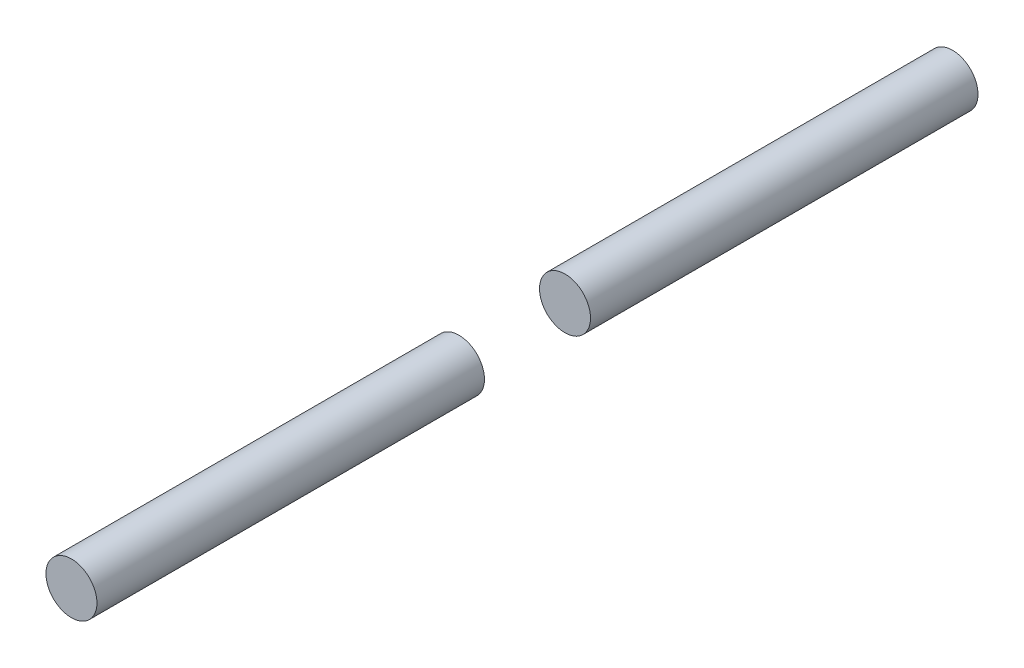
from build123d import *

# Parameters (mm, degrees)
BOSS_EXTRUDE1_START     = -96.52
BOSS_EXTRUDE1_OUTLINE_R = 6.35
BOSS_EXTRUDE1_DEPTH     = 96.52
SKETCH3_R               = 6.35
BOSS_EXTRUDE2_DEPTH     = 96.52


# Read off the part's stored shape, not the designer's step: Boss-Extrude1
with BuildPart() as part:
    # Boss-Extrude1 outline → Boss-Extrude1 (new body)
    with BuildSketch(Plane.XY.offset(196.596).offset(BOSS_EXTRUDE1_START)):
        Circle(BOSS_EXTRUDE1_OUTLINE_R)
    extrude(amount=BOSS_EXTRUDE1_DEPTH)


with BuildPart() as body_2:
    # Sketch3 → Boss-Extrude2 (new body)
    with BuildSketch(Plane.XY.offset(73.66)):
        Circle(SKETCH3_R)
    extrude(amount=-BOSS_EXTRUDE2_DEPTH)


solid = Compound([part.part, body_2.part])
